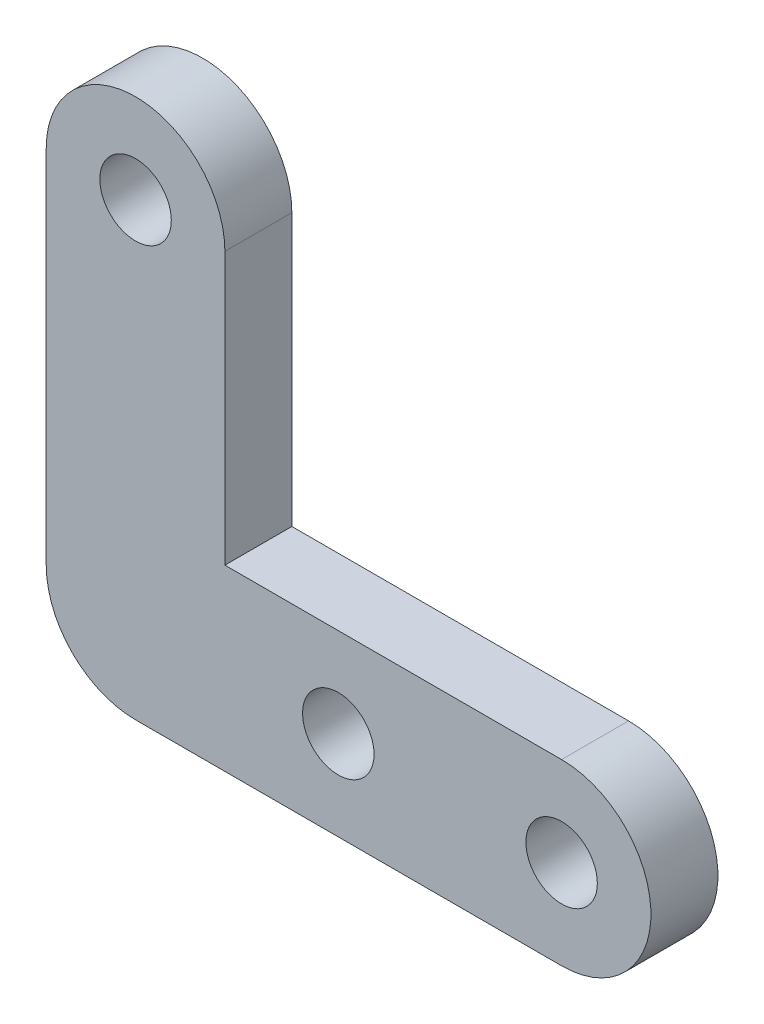
from build123d import *

# Parameters (mm, degrees)
SKETCH_1_R              = 1.6
EXTRUDE_1_DEPTH         = 4
SHEET_METAL_1_OUTLINE_R = 1.6
SHEET_METAL_1_DEPTH     = 1


# Read off the part's stored shape, not the designer's step: 轉換-實體1
with BuildPart() as part:
    # Sketch 1 → 填料-伸長1 (new body)
    # profile 1 of 3: a face of its own
    with BuildSketch(Plane.XY):
        with BuildLine():
            ThreePointArc((-4, 0), (-2.828427125, 2.828427125), (0, 4))
            Line((0, 4), (4, 4))
            Line((4, 4), (4, 16.17))
            ThreePointArc((4, 16.17), (0, 20.17), (-4, 16.17))
            Line((-4, 16.17), (-4, 0))
        make_face()
        with Locations((0, 16.17)):
            Circle(SKETCH_1_R, mode=Mode.SUBTRACT)
    # profile 2 of 3: a face of its own
    with BuildSketch(Plane.XY):
        with BuildLine():
            Line((4, 4), (0, 4))
            ThreePointArc((0, 4), (-2.828427125, 2.828427125), (-4, 0))
            ThreePointArc((-4, 0), (-2.828427125, -2.828427125), (0, -4))
            ThreePointArc((0, -4), (2.828427125, -2.828427125), (4, 0))
            Line((4, 0), (4, 4))
        make_face()
    # profile 3 of 3: a face of its own
    with BuildSketch(Plane.XY):
        with BuildLine():
            Line((19.08, 4), (4, 4))
            Line((4, 4), (4, 0))
            ThreePointArc((4, 0), (2.828427125, -2.828427125), (0, -4))
            Line((0, -4), (19.08, -4))
            ThreePointArc((19.08, -4), (23.08, 0), (19.08, 4))
        make_face()
        with Locations((9.08, 0)):
            Circle(SKETCH_1_R, mode=Mode.SUBTRACT)
        with Locations((19.08, 0)):
            Circle(SKETCH_1_R, mode=Mode.SUBTRACT)
    extrude(amount=EXTRUDE_1_DEPTH)

    # Sheet Metal 1 outline → Sheet Metal 1 (cut)
    with BuildSketch(Plane.XY):
        with BuildLine():
            ThreePointArc((4, 16.17), (0, 20.17), (-4, 16.17))
            Line((-4, 16.17), (-4, 0))
            ThreePointArc((-4, 0), (-2.828427125, -2.828427125), (0, -4))
            Line((0, -4), (19.08, -4))
            ThreePointArc((19.08, -4), (23.08, 0), (19.08, 4))
            Line((19.08, 4), (4, 4))
            Line((4, 4), (4, 16.17))
        make_face()
        with Locations((9.08, 0)):
            Circle(SHEET_METAL_1_OUTLINE_R, mode=Mode.SUBTRACT)
        with Locations((19.08, 0)):
            Circle(SHEET_METAL_1_OUTLINE_R, mode=Mode.SUBTRACT)
        with Locations((0, 16.17)):
            Circle(SHEET_METAL_1_OUTLINE_R, mode=Mode.SUBTRACT)
    extrude(amount=SHEET_METAL_1_DEPTH, mode=Mode.SUBTRACT)


solid = part.part
